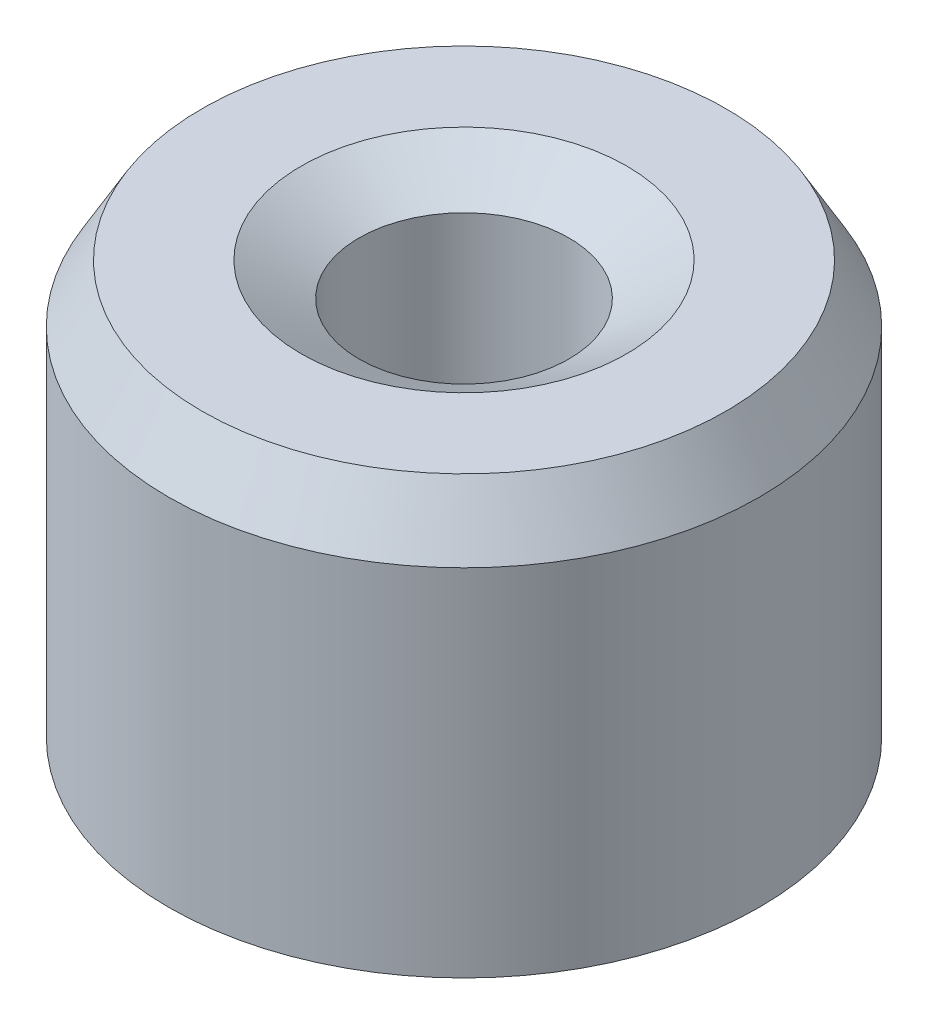
from build123d import *
from OCP.BRepFilletAPI import BRepFilletAPI_MakeChamfer

# Parameters (mm, degrees)
SKETCH1_R           = 15
BOSS_EXTRUDE1_DEPTH = 22.666909234
SKETCH2_R           = 5.329845135
CUT_EXTRUDE1_DEPTH  = 32.044947644
CHAMFER1_SIZE       = 2.933904323
CHAMFER1_SIZE2      = 1.693890451


with BuildPart() as part:
    # Sketch1 → Boss-Extrude1 (new body)
    with BuildSketch(Plane(origin=(0, 0, 0), x_dir=(1, 0, 0), z_dir=(0, 1, 0))):
        Circle(SKETCH1_R)
    extrude(amount=BOSS_EXTRUDE1_DEPTH)

    # Sketch2 → Cut-Extrude1 (cut, through all)
    with BuildSketch(Plane(origin=(0, 0, 0), x_dir=(1, 0, 0), z_dir=(0, 1, 0))):
        Circle(SKETCH2_R)
    extrude(amount=CUT_EXTRUDE1_DEPTH, mode=Mode.SUBTRACT)

    # Chamfer1: one chamfer whose edges measure the first distance from different faces: ONE call of the kernel's chamfer builder (chamfer() names one face for all edges)
    chamfer1_edges_1 = [part.edges().sort_by_distance(p)[0] for p in [
        (-5.329845135, 22.666909234, 0),
    ]]
    chamfer1_side_1 = [part.faces().sort_by_distance(p)[0] for p in [
        (-14.575735931, 22.666909234, 0),
    ]]
    chamfer1_edges_2 = [part.edges().sort_by_distance(p)[0] for p in [
        (-5.329845135, 0, 0),
    ]]
    chamfer1_side_2 = [part.faces().sort_by_distance(p)[0] for p in [
        (-5.329845135, 11.333454617, 0),
    ]]
    chamfer1_edges_3 = [part.edges().sort_by_distance(p)[0] for p in [
        (-15, 0, 0),
    ]]
    chamfer1_side_3 = [part.faces().sort_by_distance(p)[0] for p in [
        (-14.575735931, 0, 0),
    ]]
    chamfer1_edges_4 = [part.edges().sort_by_distance(p)[0] for p in [
        (-15, 22.666909234, 0),
    ]]
    chamfer1_side_4 = [part.faces().sort_by_distance(p)[0] for p in [
        (-15, 11.333454617, 0),
    ]]
    chamfer1 = BRepFilletAPI_MakeChamfer(part.part.solid().wrapped)
    for e in chamfer1_edges_1:
        chamfer1.Add(CHAMFER1_SIZE, CHAMFER1_SIZE2, e.wrapped, chamfer1_side_1[0].wrapped)  # the first distance lies on this face
    for e in chamfer1_edges_2:
        chamfer1.Add(CHAMFER1_SIZE, CHAMFER1_SIZE2, e.wrapped, chamfer1_side_2[0].wrapped)  # the first distance lies on this face
    for e in chamfer1_edges_3:
        chamfer1.Add(CHAMFER1_SIZE, CHAMFER1_SIZE2, e.wrapped, chamfer1_side_3[0].wrapped)  # the first distance lies on this face
    for e in chamfer1_edges_4:
        chamfer1.Add(CHAMFER1_SIZE, CHAMFER1_SIZE2, e.wrapped, chamfer1_side_4[0].wrapped)  # the first distance lies on this face
    add(Compound.cast(chamfer1.Shape()), mode=Mode.REPLACE)


solid = part.part
